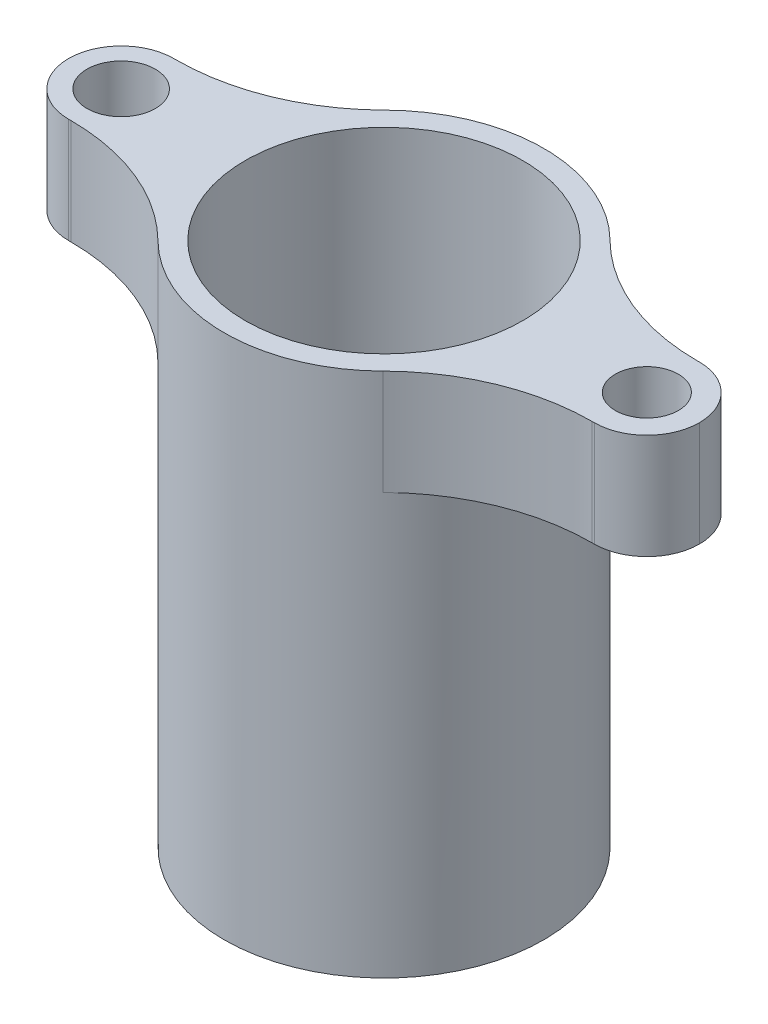
from build123d import *

# Parameters (mm, degrees)
SKETCH1_R           = 7.6
SKETCH1_R_2         = 6.6
BOSS_EXTRUDE1_DEPTH = 25
BOSS_EXTRUDE2_START = -5
SKETCH2_R           = 1.625
SKETCH2_R_2         = 1.5
BOSS_EXTRUDE2_DEPTH = 5
FILLET1_R           = 10
FILLET2_R           = 2.5


with BuildPart() as part:
    # Sketch1 → Boss-Extrude1 (new body)
    with BuildSketch(Plane(origin=(0, 0, 0), x_dir=(1, 0, 0), z_dir=(0, 1, 0))):
        with Locations(Location((0, 0, 0), (0, 0, 270))):
            Circle(SKETCH1_R)
        with Locations(Location((0, 0, 0), (0, 0, 270))):
            Circle(SKETCH1_R_2, mode=Mode.SUBTRACT)
    extrude(amount=BOSS_EXTRUDE1_DEPTH)

    # Sketch2 → Boss-Extrude2 (add)
    # profile 1 of 2: a face of its own
    with BuildSketch(Plane(origin=(0, 25, 0), x_dir=(1, 0, 0), z_dir=(0, 1, 0)).offset(BOSS_EXTRUDE2_START)):
        with BuildLine():
            Line((-6.108191222, 2.5), (-15, 2.5))
            Line((-15, 2.5), (-15, -2.5))
            Line((-15, -2.5), (-6.108191222, -2.5))
            ThreePointArc((-6.108191222, -2.5), (-6.6, 0), (-6.108191222, 2.5))
        make_face()
        with Locations(Location((-12.5, 0, 0), (0, 0, 270))):
            Circle(SKETCH2_R, mode=Mode.SUBTRACT)
    # profile 2 of 2: a face of its own
    with BuildSketch(Plane(origin=(0, 25, 0), x_dir=(1, 0, 0), z_dir=(0, 1, 0)).offset(BOSS_EXTRUDE2_START)):
        with BuildLine():
            Line((15, -2.5), (6.108191222, -2.5))
            ThreePointArc((6.108191222, -2.5), (6.6, 0), (6.108191222, 2.5))
            Line((6.108191222, 2.5), (15, 2.5))
            Line((15, 2.5), (15, -2.5))
        make_face()
        with Locations(Location((12.5, 0, 0), (0, 0, 270))):
            Circle(SKETCH2_R_2, mode=Mode.SUBTRACT)
    extrude(amount=BOSS_EXTRUDE2_DEPTH)

    # Fillet1
    fillet1_edges = [part.edges().sort_by_distance(p)[0] for p in [
        (-7.177046746, 22.5, -2.5),
        (-7.177046746, 22.5, 2.5),
        (7.177046746, 22.5, 2.5),
        (7.177046746, 22.5, -2.5),
    ]]
    fillet(fillet1_edges, radius=FILLET1_R)

    # Fillet2
    fillet2_edges = [part.edges().sort_by_distance(p)[0] for p in [
        (15, 22.5, 2.5),
        (15, 22.5, -2.5),
        (-15, 22.5, 2.5),
        (-15, 22.5, -2.5),
    ]]
    fillet(fillet2_edges, radius=FILLET2_R - 0.0001)  # a hair under: the kernel refuses the full size


solid = part.part
